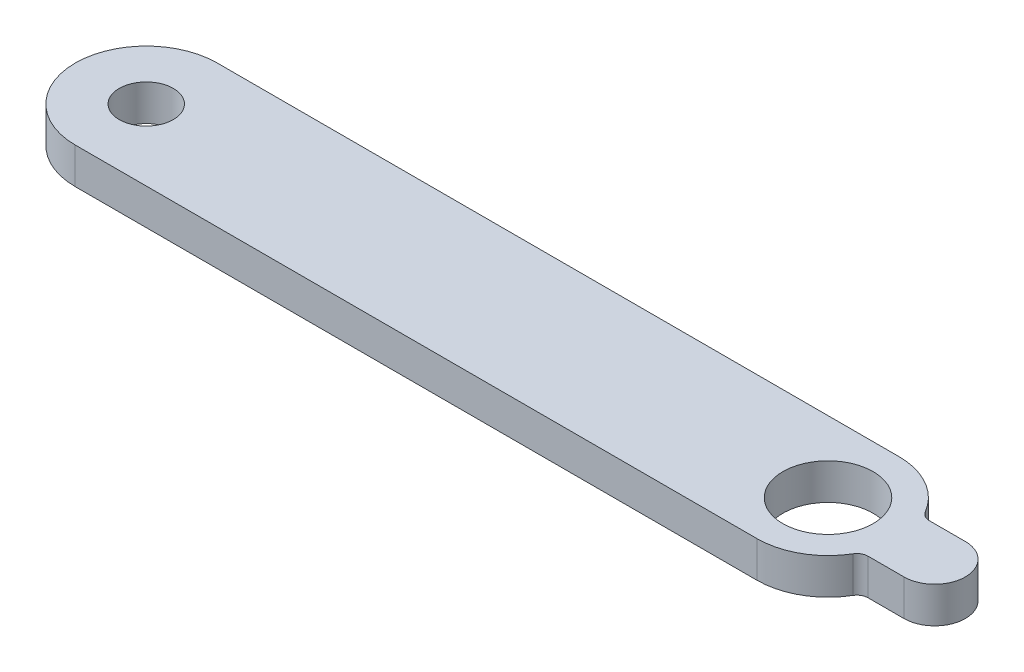
from build123d import *

# Parameters (mm, degrees)
SKETCH1_R           = 2.38
SKETCH1_R_2         = 3.97
BOSS_EXTRUDE1_DEPTH = 3.175


with BuildPart() as part:
    # Sketch1 → Boss-Extrude1 (new body)
    with BuildSketch(Plane(origin=(0, 0, 0), x_dir=(1, 0, 0), z_dir=(0, 1, 0))):
        with BuildLine():
            Line((-30.06597498, 6.287799421), (29.93402502, 6.287799421))
            ThreePointArc((29.93402502, 6.287799421), (33.02652847, 5.469090466), (35.308836634, 3.227454594))
            ThreePointArc((35.308836634, 3.227454594), (35.67400594, 2.868792854), (36.168806492, 2.737799421))
            Line((36.168806492, 2.737799421), (39.323343513, 2.737799421))
            ThreePointArc((39.323343513, 2.737799421), (42.023343513, 0.037799421), (39.323343513, -2.662200579))
            Line((39.323343513, -2.662200579), (36.168806492, -2.662200579))
            ThreePointArc((36.168806492, -2.662200579), (35.67400594, -2.793194011), (35.308836634, -3.151855751))
            ThreePointArc((35.308836634, -3.151855751), (33.02652847, -5.393491623), (29.93402502, -6.212200579))
            Line((29.93402502, -6.212200579), (-30.06597498, -6.212200579))
            ThreePointArc((-30.06597498, -6.212200579), (-36.31597498, 0.037799421), (-30.06597498, 6.287799421))
        make_face()
        with Locations((-30.06597498, 0.037799421)):
            Circle(SKETCH1_R, mode=Mode.SUBTRACT)
        with Locations((29.93402502, 0.037799421)):
            Circle(SKETCH1_R_2, mode=Mode.SUBTRACT)
    extrude(amount=BOSS_EXTRUDE1_DEPTH)


solid = part.part
